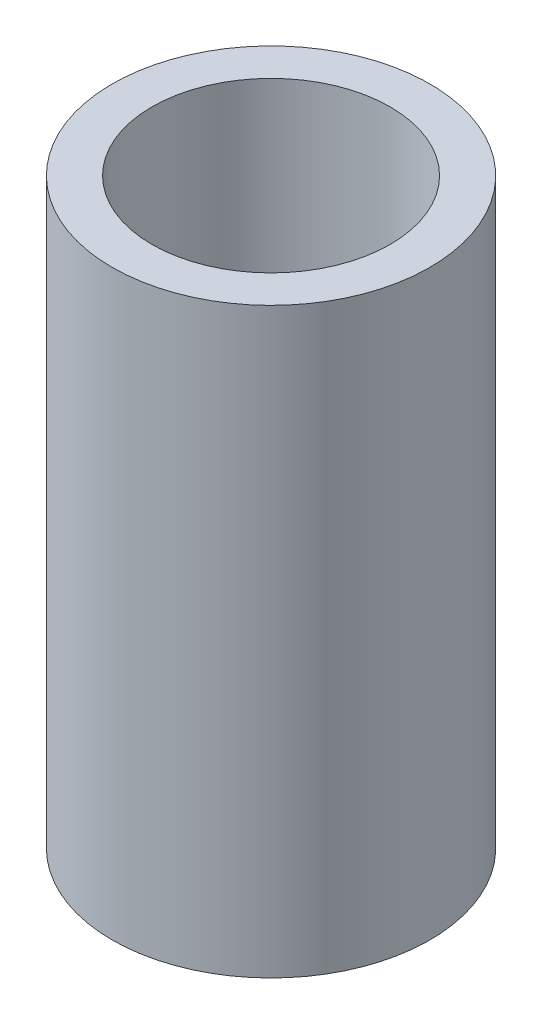
from build123d import *

# Parameters (mm, degrees)
ESQUISSE1_R        = 3
ESQUISSE1_R_2      = 2.25
BOSS_EXTRU_1_DEPTH = 11


with BuildPart() as part:
    # Esquisse1 → Boss.-Extru.1 (new body)
    with BuildSketch(Plane(origin=(0, 0, 0), x_dir=(1, 0, 0), z_dir=(0, 1, 0))):
        Circle(ESQUISSE1_R)
        Circle(ESQUISSE1_R_2, mode=Mode.SUBTRACT)
    extrude(amount=BOSS_EXTRU_1_DEPTH)


solid = part.part
